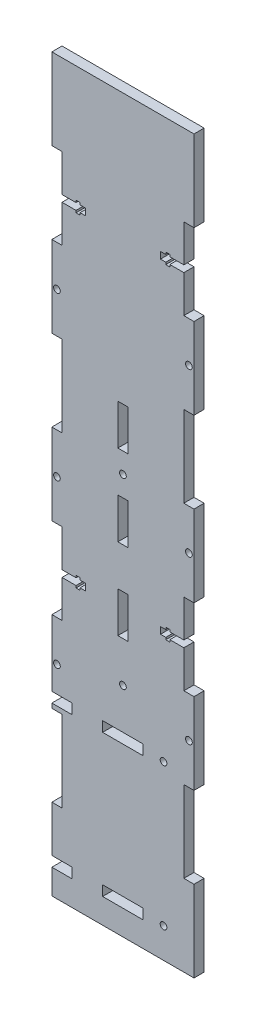
from build123d import *

# Parameters (mm, degrees)
SKETCH2_W           = 6.35
SKETCH2_H           = 88.9
BOSS_EXTRUDE1_DEPTH = 457.2
SKETCH4_W           = 6.35
SKETCH4_H           = 50.8
CUT_EXTRUDE1_DEPTH  = 524.975946925
SKETCH5_W           = 25.4
SKETCH5_H           = 6.35
CUT_EXTRUDE2_DEPTH  = 524.975946925
SKETCH6_R           = 2.0955
CUT_EXTRUDE3_DEPTH  = 524.975946925
CUT_EXTRUDE6_DEPTH  = 524.975946925
SKETCH11_R          = 2.0955
CUT_EXTRUDE7_DEPTH  = 524.975946925
SKETCH12_W          = 6.35
SKETCH12_H          = 25.4
CUT_EXTRUDE8_DEPTH  = 524.975946925
SKETCH13_R          = 2.0955
CUT_EXTRUDE9_DEPTH  = 524.975946925
SKETCH14_R          = 2.0955
CUT_EXTRUDE10_DEPTH = 524.975946925
SKETCH15_W          = 12.7
SKETCH15_H          = 6.35
CUT_EXTRUDE11_DEPTH = 524.975946925
SKETCH16_W          = 12.7
SKETCH16_H          = 6.35
CUT_EXTRUDE12_DEPTH = 524.975946925


with BuildPart() as part:
    # Sketch2 → Boss-Extrude1 (new body)
    with BuildSketch(Plane.ZX.offset(64.848530269)):
        with Locations((41.275, 0)):
            Rectangle(SKETCH2_W, SKETCH2_H)
    extrude(amount=BOSS_EXTRUDE1_DEPTH)

    # Sketch4 → Cut-Extrude1 (cut, through all)
    with BuildSketch(Plane.XY.offset(44.45)):
        with Locations((41.275, 445.848530269)):
            Rectangle(SKETCH4_W, SKETCH4_H)
        with Locations((41.275, 344.248530269)):
            Rectangle(SKETCH4_W, SKETCH4_H)
        with Locations((41.275, 242.648530269)):
            Rectangle(SKETCH4_W, SKETCH4_H)
        with Locations((41.275, 141.048530269)):
            Rectangle(SKETCH4_W, SKETCH4_H)
    cut_extrude1 = extrude(amount=-CUT_EXTRUDE1_DEPTH, mode=Mode.SUBTRACT)

    # Mirror1: Cut-Extrude1 across plane
    add(cut_extrude1.mirror(Plane(origin=(0, 0, 0), x_dir=(0, 0, 1), z_dir=(1, 0, 0))), mode=Mode.SUBTRACT)

    # Sketch5 → Cut-Extrude2 (cut, through all)
    with BuildSketch(Plane(origin=(0, 0, 38.1), x_dir=(-1, 0, 0), z_dir=(0, 0, -1))):
        with Locations((0, 83.611030269)):
            Rectangle(SKETCH5_W, SKETCH5_H)
        with Locations((0, 172.511030269)):
            Rectangle(SKETCH5_W, SKETCH5_H)
    extrude(amount=-CUT_EXTRUDE2_DEPTH, mode=Mode.SUBTRACT)

    # Sketch6 → Cut-Extrude3 (cut, through all)
    with BuildSketch(Plane.XY.offset(44.45)):
        with Locations((25.4, 172.511030269)):
            Circle(SKETCH6_R)
        with Locations((25.4, 83.611030269)):
            Circle(SKETCH6_R)
    extrude(amount=-CUT_EXTRUDE3_DEPTH, mode=Mode.SUBTRACT)

    # Sketch9 → Cut-Extrude6 (cut, through all)
    with BuildSketch(Plane.XY.offset(44.45)):
        Polygon((-38.1, 447.944030269), (-38.1, 443.753030269), (-29.337, 443.753030269), (-29.337, 442.419530269), (-26.797, 442.419530269), (-26.797, 443.753030269), (-23.495, 443.753030269), (-23.495, 447.944030269), (-26.797, 447.944030269), (-26.797, 449.277530269), (-29.337, 449.277530269), (-29.337, 447.944030269), align=None)
        Polygon((-38.1, 244.744030269), (-38.1, 240.553030269), (-29.337, 240.553030269), (-29.337, 239.219530269), (-26.797, 239.219530269), (-26.797, 240.553030269), (-23.495, 240.553030269), (-23.495, 244.744030269), (-26.797, 244.744030269), (-26.797, 246.077530269), (-29.337, 246.077530269), (-29.337, 244.744030269), align=None)
        Polygon((38.1, 447.944030269), (38.1, 443.753030269), (29.337, 443.753030269), (29.337, 442.419530269), (26.797, 442.419530269), (26.797, 443.753030269), (23.495, 443.753030269), (23.495, 447.944030269), (26.797, 447.944030269), (26.797, 449.277530269), (29.337, 449.277530269), (29.337, 447.944030269), align=None)
        Polygon((38.1, 244.744030269), (38.1, 240.553030269), (29.337, 240.553030269), (29.337, 239.219530269), (26.797, 239.219530269), (26.797, 240.553030269), (23.495, 240.553030269), (23.495, 244.744030269), (26.797, 244.744030269), (26.797, 246.077530269), (29.337, 246.077530269), (29.337, 244.744030269), align=None)
    extrude(amount=-CUT_EXTRUDE6_DEPTH, mode=Mode.SUBTRACT)

    # Sketch11 → Cut-Extrude7 (cut, through all)
    with BuildSketch(Plane.XY.offset(44.45)):
        with Locations((0, 201.086030269)):
            Circle(SKETCH11_R)
        with Locations((0, 315.386030269)):
            Circle(SKETCH11_R)
    extrude(amount=-CUT_EXTRUDE7_DEPTH, mode=Mode.SUBTRACT)

    # Sketch12 → Cut-Extrude8 (cut, through all)
    with BuildSketch(Plane(origin=(0, 0, 38.1), x_dir=(-1, 0, 0), z_dir=(0, 0, -1))):
        with Locations((0, 340.786030269)):
            Rectangle(SKETCH12_W, SKETCH12_H)
        with Locations((0, 289.986030269)):
            Rectangle(SKETCH12_W, SKETCH12_H)
        with Locations((0, 239.186030269)):
            Rectangle(SKETCH12_W, SKETCH12_H)
    extrude(amount=-CUT_EXTRUDE8_DEPTH, mode=Mode.SUBTRACT)

    # Sketch13 → Cut-Extrude9 (cut, through all)
    with BuildSketch(Plane(origin=(0, 0, 38.1), x_dir=(-1, 0, 0), z_dir=(0, 0, -1))):
        with Locations((-41.275, 395.048530269)):
            Circle(SKETCH13_R)
        with Locations((-41.275, 191.848530269)):
            Circle(SKETCH13_R)
        with Locations((-41.275, 293.448530269)):
            Circle(SKETCH13_R)
    extrude(amount=-CUT_EXTRUDE9_DEPTH, mode=Mode.SUBTRACT)

    # Sketch14 → Cut-Extrude10 (cut, through all)
    with BuildSketch(Plane(origin=(0, 0, 38.1), x_dir=(-1, 0, 0), z_dir=(0, 0, -1))):
        with Locations((41.275, 395.048530269)):
            Circle(SKETCH14_R)
        with Locations((41.275, 293.448530269)):
            Circle(SKETCH14_R)
        with Locations((41.275, 191.848530269)):
            Circle(SKETCH14_R)
    extrude(amount=-CUT_EXTRUDE10_DEPTH, mode=Mode.SUBTRACT)

    # Sketch15 → Cut-Extrude11 (cut, through all)
    with BuildSketch(Plane(origin=(0, 0, 38.1), x_dir=(-1, 0, 0), z_dir=(0, 0, -1))):
        with Locations((38.1, 172.511030269)):
            Rectangle(SKETCH15_W, SKETCH15_H)
    extrude(amount=-CUT_EXTRUDE11_DEPTH, mode=Mode.SUBTRACT)

    # Sketch16 → Cut-Extrude12 (cut, through all)
    with BuildSketch(Plane(origin=(0, 0, 38.1), x_dir=(-1, 0, 0), z_dir=(0, 0, -1))):
        with Locations((38.1, 83.611030269)):
            Rectangle(SKETCH16_W, SKETCH16_H)
    extrude(amount=-CUT_EXTRUDE12_DEPTH, mode=Mode.SUBTRACT)


solid = part.part
